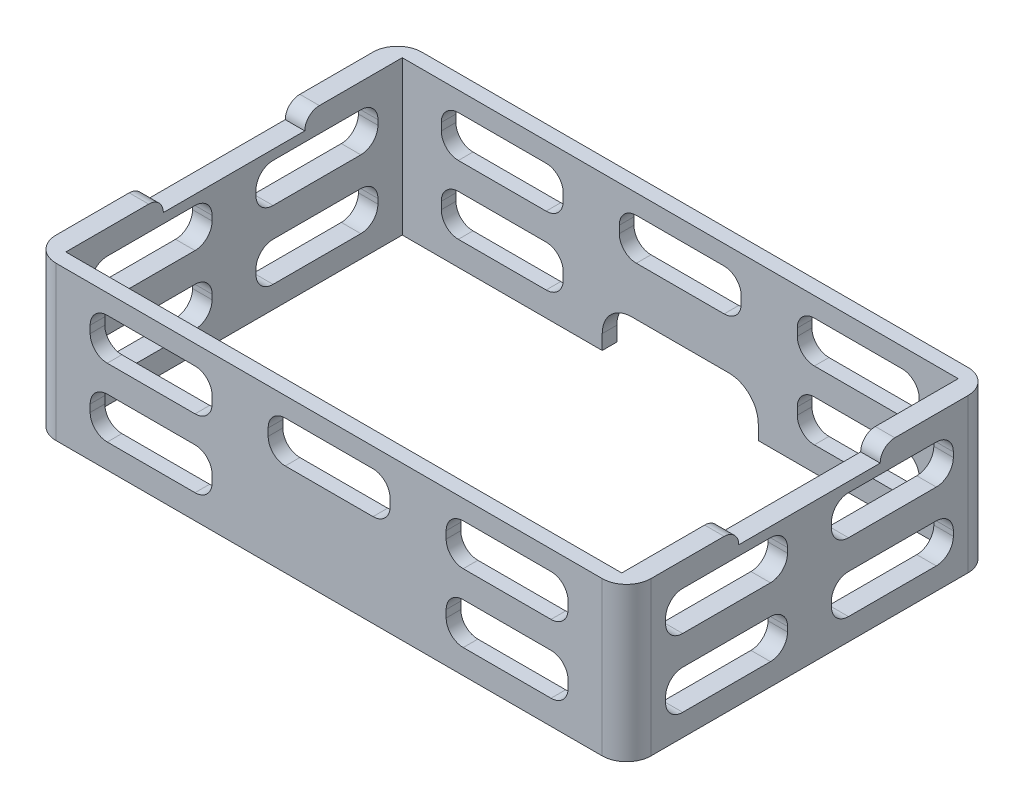
from build123d import *

# Parameters (mm, degrees)
SKETCH1_W           = 61
SKETCH1_H           = 37.5
BOSS_EXTRUDE1_DEPTH = 15.75
SKETCH2_W           = 57
SKETCH2_H           = 34.5
CUT_EXTRUDE1_DEPTH  = 15.75
SKETCH3_W           = 2
SKETCH3_H           = 14.5
CUT_EXTRUDE2_DEPTH  = 1.5
FILLET1_R           = 1.5
FILLET2_R           = 1.5
FILLET3_R           = 1.5
FILLET4_R           = 1.5
FILLET5_R           = 2.5
FILLET6_R           = 2.5
FILLET7_R           = 2.5
FILLET8_R           = 2.5
SKETCH4_W           = 16
SKETCH4_H           = 4.5
CUT_EXTRUDE3_DEPTH  = 1.5
FILLET9_R           = 3
FILLET10_R          = 3
CUT_EXTRUDE4_DEPTH  = 37.5
CUT_EXTRUDE5_DEPTH  = 61


with BuildPart() as part:
    # Sketch1 → Boss-Extrude1 (new body)
    with BuildSketch(Plane(origin=(0, 0, 0), x_dir=(1, 0, 0), z_dir=(0, 1, 0))):
        with Locations((-89.690320201, -63.294495763)):
            Rectangle(SKETCH1_W, SKETCH1_H)
    extrude(amount=BOSS_EXTRUDE1_DEPTH)

    # Sketch2 → Cut-Extrude1 (cut)
    with BuildSketch(Plane(origin=(0, 15.75, 0), x_dir=(1, 0, 0), z_dir=(0, 1, 0))):
        with Locations((-89.690320201, -63.294495763)):
            Rectangle(SKETCH2_W, SKETCH2_H)
    extrude(amount=-CUT_EXTRUDE1_DEPTH, mode=Mode.SUBTRACT)

    # Sketch3 → Cut-Extrude2 (cut)
    with BuildSketch(Plane(origin=(0, 15.75, 0), x_dir=(1, 0, 0), z_dir=(0, 1, 0))):
        with Locations((-119.190320201, -63.294495763)):
            Rectangle(SKETCH3_W, SKETCH3_H)
        with Locations((-60.190320201, -63.294495763)):
            Rectangle(SKETCH3_W, SKETCH3_H)
    extrude(amount=-CUT_EXTRUDE2_DEPTH, mode=Mode.SUBTRACT)

    # Fillet1
    fillet1_edges = [part.edges().sort_by_distance(p)[0] for p in [
        (-119.190320201, 15.75, 56.044495763),
    ]]
    fillet(fillet1_edges, radius=FILLET1_R - 0.0001)  # a hair under: the kernel refuses the full size

    # Fillet2
    fillet2_edges = [part.edges().sort_by_distance(p)[0] for p in [
        (-119.190320201, 15.75, 70.544495763),
    ]]
    fillet(fillet2_edges, radius=FILLET2_R - 0.0001)  # a hair under: the kernel refuses the full size

    # Fillet3
    fillet3_edges = [part.edges().sort_by_distance(p)[0] for p in [
        (-60.190320201, 15.75, 70.544495763),
    ]]
    fillet(fillet3_edges, radius=FILLET3_R - 0.0001)  # a hair under: the kernel refuses the full size

    # Fillet4
    fillet4_edges = [part.edges().sort_by_distance(p)[0] for p in [
        (-60.190320201, 15.75, 56.044495763),
    ]]
    fillet(fillet4_edges, radius=FILLET4_R - 0.0001)  # a hair under: the kernel refuses the full size

    # Fillet5
    fillet5_edges = [part.edges().sort_by_distance(p)[0] for p in [
        (-120.190320201, 7.875, 82.044495763),
    ]]
    fillet(fillet5_edges, radius=FILLET5_R)

    # Fillet6
    fillet6_edges = [part.edges().sort_by_distance(p)[0] for p in [
        (-120.190320201, 7.875, 44.544495763),
    ]]
    fillet(fillet6_edges, radius=FILLET6_R)

    # Fillet7
    fillet7_edges = [part.edges().sort_by_distance(p)[0] for p in [
        (-59.190320201, 7.875, 44.544495763),
    ]]
    fillet(fillet7_edges, radius=FILLET7_R)

    # Fillet8
    fillet8_edges = [part.edges().sort_by_distance(p)[0] for p in [
        (-59.190320201, 7.875, 82.044495763),
    ]]
    fillet(fillet8_edges, radius=FILLET8_R)

    # Sketch4 → Cut-Extrude3 (cut)
    with BuildSketch(Plane(origin=(0, 0, 44.544495763), x_dir=(-1, 0, 0), z_dir=(0, 0, -1))):
        with Locations((89.690320201, 2.25)):
            Rectangle(SKETCH4_W, SKETCH4_H)
    extrude(amount=-CUT_EXTRUDE3_DEPTH, mode=Mode.SUBTRACT)

    # Fillet9
    fillet9_edges = [part.edges().sort_by_distance(p)[0] for p in [
        (-81.690320201, 4.5, 45.294495763),
    ]]
    fillet(fillet9_edges, radius=FILLET9_R)

    # Fillet10
    fillet10_edges = [part.edges().sort_by_distance(p)[0] for p in [
        (-97.690320201, 4.5, 45.294495763),
    ]]
    fillet(fillet10_edges, radius=FILLET10_R)

    # Sketch6 → Cut-Extrude4 (cut)
    with BuildSketch(Plane(origin=(0, 0, 44.544495763), x_dir=(-1, 0, 0), z_dir=(0, 0, -1))):
        with BuildLine():
            Line((66.940320201, 13.75), (75.940320201, 13.75))
            ThreePointArc((75.940320201, 13.75), (77.177757069, 13.237436867), (77.690320201, 12))
            Line((77.690320201, 12), (77.690320201, 11.25))
            ThreePointArc((77.690320201, 11.25), (77.177757069, 10.012563133), (75.940320201, 9.5))
            Line((75.940320201, 9.5), (66.940320201, 9.5))
            ThreePointArc((66.940320201, 9.5), (65.702883334, 10.012563133), (65.190320201, 11.25))
            Line((65.190320201, 11.25), (65.190320201, 12))
            ThreePointArc((65.190320201, 12), (65.702883334, 13.237436867), (66.940320201, 13.75))
        make_face()
        with BuildLine():
            Line((83.440320201, 12), (83.440320201, 11.25))
            ThreePointArc((83.440320201, 11.25), (83.952883334, 10.012563133), (85.190320201, 9.5))
            Line((85.190320201, 9.5), (94.190320201, 9.5))
            ThreePointArc((94.190320201, 9.5), (95.427757069, 10.012563133), (95.940320201, 11.25))
            Line((95.940320201, 11.25), (95.940320201, 12))
            ThreePointArc((95.940320201, 12), (95.427757069, 13.237436867), (94.190320201, 13.75))
            Line((94.190320201, 13.75), (85.190320201, 13.75))
            ThreePointArc((85.190320201, 13.75), (83.952883334, 13.237436867), (83.440320201, 12))
        make_face()
        with BuildLine():
            Line((101.690320201, 12), (101.690320201, 11.25))
            ThreePointArc((101.690320201, 11.25), (102.202883334, 10.012563133), (103.440320201, 9.5))
            Line((103.440320201, 9.5), (112.440320201, 9.5))
            ThreePointArc((112.440320201, 9.5), (113.677757069, 10.012563133), (114.190320201, 11.25))
            Line((114.190320201, 11.25), (114.190320201, 12))
            ThreePointArc((114.190320201, 12), (113.677757069, 13.237436867), (112.440320201, 13.75))
            Line((112.440320201, 13.75), (103.440320201, 13.75))
            ThreePointArc((103.440320201, 13.75), (102.202883334, 13.237436867), (101.690320201, 12))
        make_face()
        with BuildLine():
            Line((101.690320201, 5), (101.690320201, 4.25))
            ThreePointArc((101.690320201, 4.25), (102.202883334, 3.012563133), (103.440320201, 2.5))
            Line((103.440320201, 2.5), (112.440320201, 2.5))
            ThreePointArc((112.440320201, 2.5), (113.677757069, 3.012563133), (114.190320201, 4.25))
            Line((114.190320201, 4.25), (114.190320201, 5))
            ThreePointArc((114.190320201, 5), (113.677757069, 6.237436867), (112.440320201, 6.75))
            Line((112.440320201, 6.75), (103.440320201, 6.75))
            ThreePointArc((103.440320201, 6.75), (102.202883334, 6.237436867), (101.690320201, 5))
        make_face()
        with BuildLine():
            Line((65.190320201, 5), (65.190320201, 4.25))
            ThreePointArc((65.190320201, 4.25), (65.702883334, 3.012563133), (66.940320201, 2.5))
            Line((66.940320201, 2.5), (75.940320201, 2.5))
            ThreePointArc((75.940320201, 2.5), (77.177757069, 3.012563133), (77.690320201, 4.25))
            Line((77.690320201, 4.25), (77.690320201, 5))
            ThreePointArc((77.690320201, 5), (77.177757069, 6.237436867), (75.940320201, 6.75))
            Line((75.940320201, 6.75), (66.940320201, 6.75))
            ThreePointArc((66.940320201, 6.75), (65.702883334, 6.237436867), (65.190320201, 5))
        make_face()
    extrude(amount=-CUT_EXTRUDE4_DEPTH, mode=Mode.SUBTRACT)

    # Sketch7 → Cut-Extrude5 (cut)
    with BuildSketch(Plane.ZY.offset(120.190320201)):
        with BuildLine():
            Line((50.294495763, 13.25), (59.294495763, 13.25))
            ThreePointArc((59.294495763, 13.25), (60.53193263, 12.737436867), (61.044495763, 11.5))
            Line((61.044495763, 11.5), (61.044495763, 11))
            ThreePointArc((61.044495763, 11), (60.53193263, 9.762563133), (59.294495763, 9.25))
            Line((59.294495763, 9.25), (50.294495763, 9.25))
            ThreePointArc((50.294495763, 9.25), (49.057058896, 9.762563133), (48.544495763, 11))
            Line((48.544495763, 11), (48.544495763, 11.5))
            ThreePointArc((48.544495763, 11.5), (49.057058896, 12.737436867), (50.294495763, 13.25))
        make_face()
        with BuildLine():
            Line((65.544495763, 11.5), (65.544495763, 11))
            ThreePointArc((65.544495763, 11), (66.057058896, 9.762563133), (67.294495763, 9.25))
            Line((67.294495763, 9.25), (76.294495763, 9.25))
            ThreePointArc((76.294495763, 9.25), (77.53193263, 9.762563133), (78.044495763, 11))
            Line((78.044495763, 11), (78.044495763, 11.5))
            ThreePointArc((78.044495763, 11.5), (77.53193263, 12.737436867), (76.294495763, 13.25))
            Line((76.294495763, 13.25), (67.294495763, 13.25))
            ThreePointArc((67.294495763, 13.25), (66.057058896, 12.737436867), (65.544495763, 11.5))
        make_face()
        with BuildLine():
            Line((65.544495763, 4.5), (65.544495763, 4))
            ThreePointArc((65.544495763, 4), (66.057058896, 2.762563133), (67.294495763, 2.25))
            Line((67.294495763, 2.25), (76.294495763, 2.25))
            ThreePointArc((76.294495763, 2.25), (77.53193263, 2.762563133), (78.044495763, 4))
            Line((78.044495763, 4), (78.044495763, 4.5))
            ThreePointArc((78.044495763, 4.5), (77.53193263, 5.737436867), (76.294495763, 6.25))
            Line((76.294495763, 6.25), (67.294495763, 6.25))
            ThreePointArc((67.294495763, 6.25), (66.057058896, 5.737436867), (65.544495763, 4.5))
        make_face()
        with BuildLine():
            Line((48.544495763, 4.5), (48.544495763, 4))
            ThreePointArc((48.544495763, 4), (49.057058896, 2.762563133), (50.294495763, 2.25))
            Line((50.294495763, 2.25), (59.294495763, 2.25))
            ThreePointArc((59.294495763, 2.25), (60.53193263, 2.762563133), (61.044495763, 4))
            Line((61.044495763, 4), (61.044495763, 4.5))
            ThreePointArc((61.044495763, 4.5), (60.53193263, 5.737436867), (59.294495763, 6.25))
            Line((59.294495763, 6.25), (50.294495763, 6.25))
            ThreePointArc((50.294495763, 6.25), (49.057058896, 5.737436867), (48.544495763, 4.5))
        make_face()
    extrude(amount=-CUT_EXTRUDE5_DEPTH, mode=Mode.SUBTRACT)


solid = part.part
